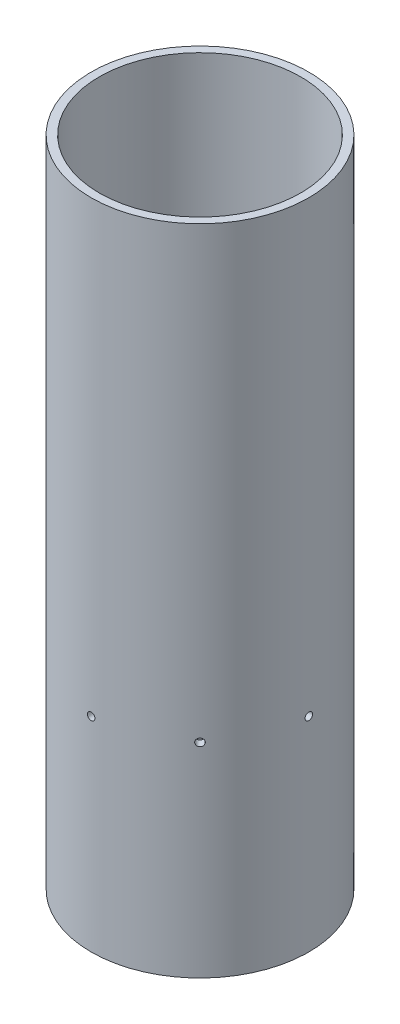
from build123d import *

# Parameters (mm, degrees)
SKETCH1_R                   = 50.8
SKETCH1_R_2                 = 46.99
BOSS_EXTRUDE1_DEPTH         = 304.8
BULKHEAD_HOLES_REACH        = 327.279
SKETCH2_R                   = 1.7526
BULKHEAD_HOLE_PATTERN_COUNT = 8


with BuildPart() as part:
    # Sketch1 → Boss-Extrude1 (new body)
    with BuildSketch(Plane(origin=(0, 0, 0), x_dir=(1, 0, 0), z_dir=(0, 1, 0))):
        Circle(SKETCH1_R)
        Circle(SKETCH1_R_2, mode=Mode.SUBTRACT)
    extrude(amount=BOSS_EXTRUDE1_DEPTH)

    # Sketch2 → Bulkhead Holes (cut, up to next)
    with BuildSketch(Plane(origin=(50.8, 0, 0), x_dir=(0, 0, -1), z_dir=(1, 0, 0)), mode=Mode.PRIVATE) as bulkhead_holes_sk1:
        with Locations((0, 95.25)):
            Circle(SKETCH2_R)
    bulkhead_holes_tool1 = extrude(bulkhead_holes_sk1.sketch, amount=-BULKHEAD_HOLES_REACH, mode=Mode.PRIVATE) & part.part
    bulkhead_holes = bulkhead_holes_tool1.solids().sort_by_distance((50.8, 95.25, 0))[0]
    add(bulkhead_holes, mode=Mode.SUBTRACT)

    # Bulkhead Hole Pattern: Bulkhead Holes ×8 about axis
    bulkhead_hole_pattern_axis = Axis((0, 0, 0), (0, 1, 0))
    for i in range(1, BULKHEAD_HOLE_PATTERN_COUNT):
        add(bulkhead_holes.rotate(bulkhead_hole_pattern_axis, i * 360 / BULKHEAD_HOLE_PATTERN_COUNT), mode=Mode.SUBTRACT)


solid = part.part
